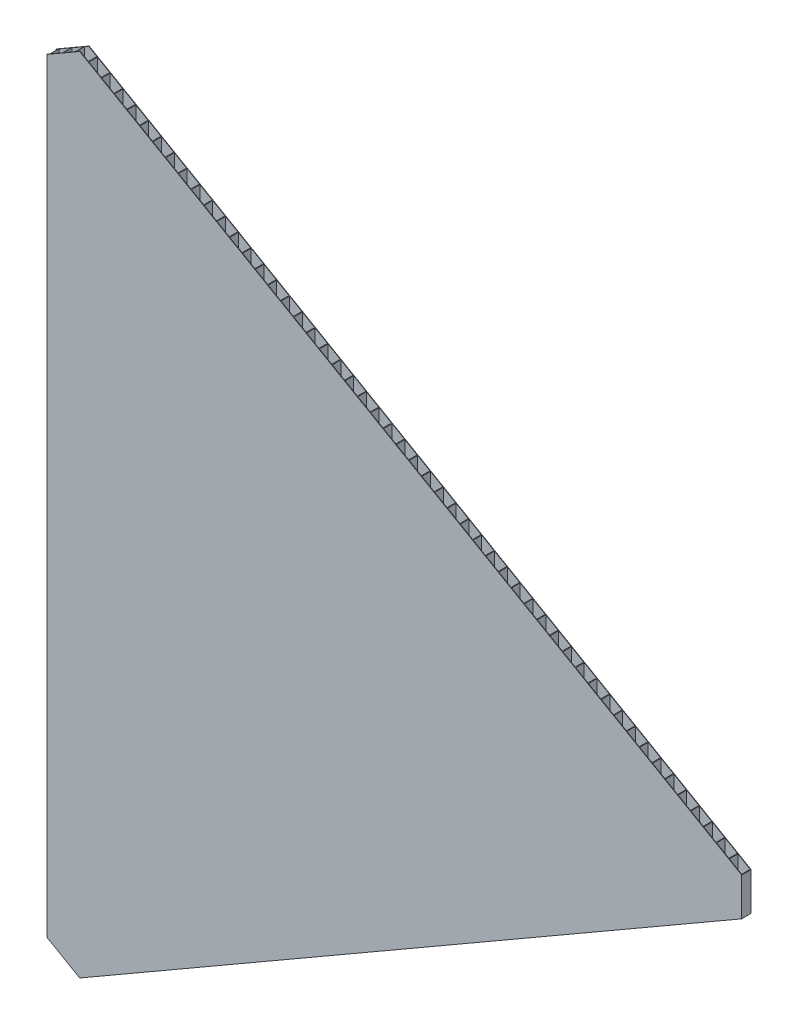
from build123d import *

# Parameters (mm, degrees)
EXTRUDE_1_DEPTH     = 5
CUT_EXTRUDE_START   = 0.25
CUT_EXTRUDE_1_DEPTH = 4.5


# Read off the part's stored shape, not the designer's step: ｶｯﾄ - 押し出し1
with BuildPart() as part:
    # ｽｹｯﾁ1 → ﾎﾞｽ - 押し出し1 (new body)
    with BuildSketch(Plane.XY):
        Polygon((-110.506412591, 211.40272117), (-127.826920667, 201.40272117), (-127.826920667, -201.40272117), (-110.506412591, -211.40272117), (238.333333258, -10), (238.333333258, 10), align=None)
    extrude(amount=EXTRUDE_1_DEPTH)

    # ｶｯﾄ - 押し出し1 outline → ｶｯﾄ - 押し出し1 (cut)
    with BuildSketch(Plane.XY.offset(CUT_EXTRUDE_START)):
        Polygon((231.583333258, -13.897114317), (238.083333258, -10.144337567), (238.083333258, 10.144337567), (231.583333258, 13.897114317), align=None)
        Polygon((224.833339157, -17.794225228), (231.333339157, -14.041448478), (231.333339157, 14.041448478), (224.833339157, 17.794225228), align=None)
        Polygon((218.083345056, -21.691336139), (224.583345056, -17.93855939), (224.583345056, 17.938559389), (218.083345056, 21.691336139), align=None)
        Polygon((211.333350956, -25.58844705), (217.833350956, -21.8356703), (217.833350956, 21.8356703), (211.333350956, 25.58844705), align=None)
        Polygon((204.583356855, -29.485557961), (211.083356855, -25.732781212), (211.083356855, 25.732781212), (204.583356855, 29.485557961), align=None)
        Polygon((197.833362754, -33.382668872), (204.333362754, -29.629892123), (204.333362754, 29.629892123), (197.833362754, 33.382668872), align=None)
        Polygon((191.083368653, -37.279779784), (197.583368653, -33.527003034), (197.583368653, 33.527003034), (191.083368653, 37.279779784), align=None)
        Polygon((184.333374553, -41.176890694), (190.833374553, -37.424113945), (190.833374553, 37.424113945), (184.333374553, 41.176890694), align=None)
        Polygon((177.583380452, -45.074001606), (184.083380452, -41.321224856), (184.083380452, 41.321224856), (177.583380452, 45.074001606), align=None)
        Polygon((170.833386351, -48.971112517), (177.333386351, -45.218335767), (177.333386351, 45.218335767), (170.833386351, 48.971112517), align=None)
        Polygon((164.083392251, -52.868223428), (170.583392251, -49.115446678), (170.583392251, 49.115446678), (164.083392251, 52.868223428), align=None)
        Polygon((157.33339815, -56.765334339), (163.83339815, -53.012557589), (163.83339815, 53.012557589), (157.33339815, 56.765334339), align=None)
        Polygon((150.583404049, -60.66244525), (157.083404049, -56.9096685), (157.083404049, 56.9096685), (150.583404049, 60.66244525), align=None)
        Polygon((143.833409949, -64.559556161), (150.333409949, -60.806779411), (150.333409949, 60.806779411), (143.833409949, 64.559556161), align=None)
        Polygon((137.083415848, -68.456667072), (143.583415848, -64.703890322), (143.583415848, 64.703890322), (137.083415848, 68.456667072), align=None)
        Polygon((130.333421747, -72.353777983), (136.833421747, -68.601001233), (136.833421747, 68.601001233), (130.333421747, 72.353777983), align=None)
        Polygon((123.583427646, -76.250888894), (130.083427646, -72.498112145), (130.083427646, 72.498112144), (123.583427646, 76.250888894), align=None)
        Polygon((116.833433546, -80.147999805), (123.333433546, -76.395223055), (123.333433546, 76.395223055), (116.833433546, 80.147999805), align=None)
        Polygon((110.083439445, -84.045110716), (116.583439445, -80.292333967), (116.583439445, 80.292333966), (110.083439445, 84.045110716), align=None)
        Polygon((103.333445344, -87.942221628), (109.833445344, -84.189444878), (109.833445344, 84.189444878), (103.333445344, 87.942221628), align=None)
        Polygon((96.583451244, -91.839332538), (103.083451244, -88.086555789), (103.083451244, 88.086555789), (96.583451244, 91.839332538), align=None)
        Polygon((89.833457143, -95.736443449), (96.333457143, -91.9836667), (96.333457143, 91.9836667), (89.833457143, 95.736443449), align=None)
        Polygon((83.083463042, -99.633554361), (89.583463042, -95.880777611), (89.583463042, 95.880777611), (83.083463042, 99.633554361), align=None)
        Polygon((76.333468942, -103.530665272), (82.833468942, -99.777888522), (82.833468942, 99.777888522), (76.333468942, 103.530665272), align=None)
        Polygon((69.583474841, -107.427776183), (76.083474841, -103.674999433), (76.083474841, 103.674999433), (69.583474841, 107.427776183), align=None)
        Polygon((62.83348074, -111.324887094), (69.33348074, -107.572110344), (69.33348074, 107.572110344), (62.83348074, 111.324887094), align=None)
        Polygon((56.08348664, -115.221998005), (62.58348664, -111.469221255), (62.58348664, 111.469221255), (56.08348664, 115.221998005), align=None)
        Polygon((49.333492539, -119.119108916), (55.833492539, -115.366332166), (55.833492539, 115.366332166), (49.333492539, 119.119108916), align=None)
        Polygon((42.583498438, -123.016219827), (49.083498438, -119.263443077), (49.083498438, 119.263443077), (42.583498438, 123.016219827), align=None)
        Polygon((35.833504337, -126.913330738), (42.333504337, -123.160553989), (42.333504337, 123.160553988), (35.833504337, 126.913330738), align=None)
        Polygon((29.083510237, -130.810441649), (35.583510237, -127.057664899), (35.583510237, 127.057664899), (29.083510237, 130.810441649), align=None)
        Polygon((22.333516136, -134.70755256), (28.833516136, -130.95477581), (28.833516136, 130.95477581), (22.333516136, 134.70755256), align=None)
        Polygon((15.583522035, -138.604663471), (22.083522035, -134.851886722), (22.083522035, 134.851886721), (15.583522035, 138.604663471), align=None)
        Polygon((8.833527935, -142.501774382), (15.333527935, -138.748997632), (15.333527935, 138.748997632), (8.833527935, 142.501774382), align=None)
        Polygon((2.083533834, -146.398885293), (8.583533834, -142.646108544), (8.583533834, 142.646108544), (2.083533834, 146.398885293), align=None)
        Polygon((-4.666460267, -150.295996205), (1.833539733, -146.543219455), (1.833539733, 146.543219455), (-4.666460267, 150.295996205), align=None)
        Polygon((-11.416454367, -154.193107115), (-4.916454367, -150.440330366), (-4.916454367, 150.440330366), (-11.416454367, 154.193107115), align=None)
        Polygon((-18.166448468, -158.090218026), (-11.666448468, -154.337441277), (-11.666448468, 154.337441277), (-18.166448468, 158.090218026), align=None)
        Polygon((-24.916442569, -161.987328938), (-18.416442569, -158.234552188), (-18.416442569, 158.234552188), (-24.916442569, 161.987328938), align=None)
        Polygon((-31.66643667, -165.884439849), (-25.16643667, -162.131663099), (-25.16643667, 162.131663099), (-31.66643667, 165.884439849), align=None)
        Polygon((-38.41643077, -169.78155076), (-31.91643077, -166.02877401), (-31.91643077, 166.02877401), (-38.41643077, 169.78155076), align=None)
        Polygon((-45.166424871, -173.678661671), (-38.666424871, -169.925884921), (-38.666424871, 169.925884921), (-45.166424871, 173.678661671), align=None)
        Polygon((-51.916418972, -177.575772582), (-45.416418972, -173.822995832), (-45.416418972, 173.822995832), (-51.916418972, 177.575772582), align=None)
        Polygon((-58.666413072, -181.472883493), (-52.166413072, -177.720106743), (-52.166413072, 177.720106743), (-58.666413072, 181.472883493), align=None)
        Polygon((-65.416407173, -185.369994404), (-58.916407173, -181.617217654), (-58.916407173, 181.617217654), (-65.416407173, 185.369994404), align=None)
        Polygon((-72.166401274, -189.267105315), (-65.666401274, -185.514328565), (-65.666401274, 185.514328565), (-72.166401274, 189.267105315), align=None)
        Polygon((-78.916395374, -193.164216226), (-72.416395374, -189.411439476), (-72.416395374, 189.411439476), (-78.916395374, 193.164216226), align=None)
        Polygon((-85.666389475, -197.061327137), (-79.166389475, -193.308550387), (-79.166389475, 193.308550387), (-85.666389475, 197.061327137), align=None)
        Polygon((-92.416383576, -200.958438048), (-85.916383576, -197.205661299), (-85.916383576, 197.205661298), (-92.416383576, 200.958438048), align=None)
        Polygon((-99.166377677, -204.85554896), (-92.666377677, -201.10277221), (-92.666377677, 201.10277221), (-99.166377677, 204.85554896), align=None)
        Polygon((-105.916371777, -208.75265987), (-99.416371777, -204.999883121), (-99.416371777, 204.999883121), (-105.916371777, 208.75265987), align=None)
        Polygon((-110.506412591, -211.40272117), (-106.166365878, -208.896994032), (-106.166365878, 208.896994032), (-110.506412591, 211.40272117), (-112.666365878, 210.155671558), (-112.666365878, -210.155671558), align=None)
        Polygon((-119.416359979, -206.258560647), (-112.916359979, -210.011337397), (-112.916359979, 210.011337397), (-119.416359979, 206.258560647), align=None)
        Polygon((-126.166354079, -202.361449736), (-119.666354079, -206.114226486), (-119.666354079, 206.114226486), (-126.166354079, 202.361449736), align=None)
        Polygon((-127.826920667, -201.40272117), (-126.41634818, -202.217115575), (-126.41634818, 202.217115575), (-127.826920667, 201.40272117), align=None)
    extrude(amount=CUT_EXTRUDE_1_DEPTH, mode=Mode.SUBTRACT)


solid = part.part
